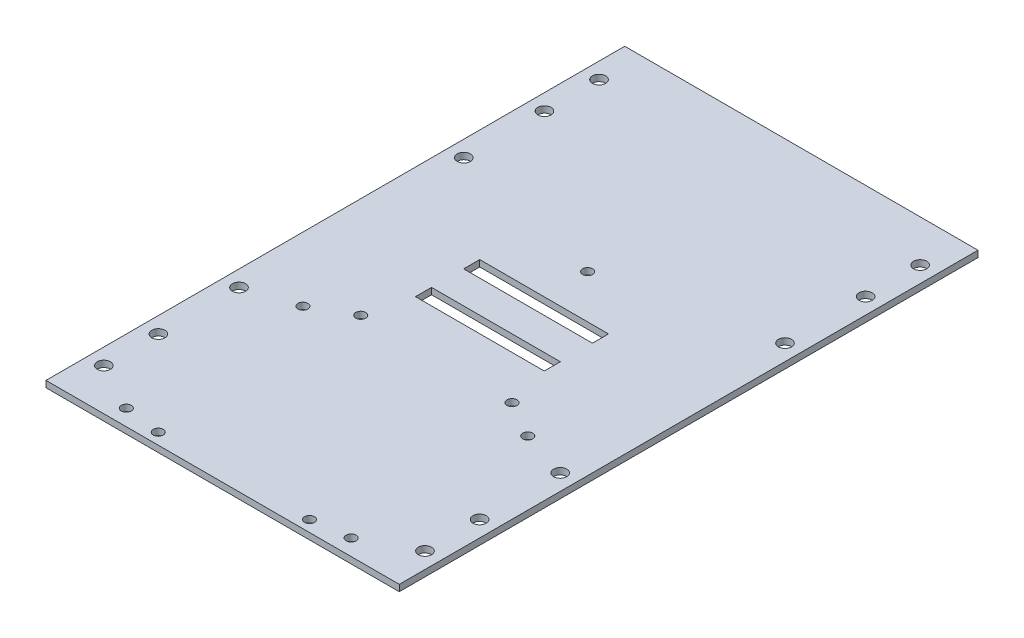
from build123d import *

# Parameters (mm, degrees)
SKETCH1_W           = 55
SKETCH1_H           = 90.1
SKETCH1_R           = 2.05
BOSS_EXTRUDE2_DEPTH = 2
MIRROR1_OUTLINE_W   = 55
MIRROR1_OUTLINE_H   = 90.1
MIRROR1_OUTLINE_R   = 2.05
MIRROR1_DEPTH       = 2
SKETCH2_W           = 40.1
SKETCH2_H           = 5
CUT_EXTRUDE1_DEPTH  = 10
SKETCH3_R           = 1.55
CUT_EXTRUDE2_DEPTH  = 10


# Read off the part's stored shape, not the designer's step: Mirror1
with BuildPart() as part:
    # Sketch1 → Boss-Extrude2 (new body)
    with BuildSketch(Plane(origin=(0, 0, 0), x_dir=(1, 0, 0), z_dir=(0, 1, 0))):
        with Locations((27.5, 45.05)):
            Rectangle(SKETCH1_W, SKETCH1_H)
        with Locations(Location((50, 77.1, 0), (0, 0, 270))):
            Circle(SKETCH1_R, mode=Mode.SUBTRACT)
        with Locations(Location((50, 60.1, 0), (0, 0, 270))):
            Circle(SKETCH1_R, mode=Mode.SUBTRACT)
        with Locations(Location((50, 35, 0), (0, 0, 270))):
            Circle(SKETCH1_R, mode=Mode.SUBTRACT)
    extrude(amount=BOSS_EXTRUDE2_DEPTH)

    # Mirror1 outline → Mirror1 (add)
    with BuildSketch(Plane(origin=(0, 0, 0), x_dir=(1, 0, 0), z_dir=(0, 1, 0))):
        with Locations((-27.5, 45.05)):
            Rectangle(MIRROR1_OUTLINE_W, MIRROR1_OUTLINE_H)
        with Locations((-50, 35)):
            Circle(MIRROR1_OUTLINE_R, mode=Mode.SUBTRACT)
        with Locations((-50, 60.1)):
            Circle(MIRROR1_OUTLINE_R, mode=Mode.SUBTRACT)
        with Locations((-50, 77.1)):
            Circle(MIRROR1_OUTLINE_R, mode=Mode.SUBTRACT)
    extrude(amount=MIRROR1_DEPTH)

    # Mirror2: part across plane


with BuildPart() as part_1:
    add(part.part)
    add(part.part.mirror(Plane(origin=(0, 2, 0), x_dir=(1, 0, 0), z_dir=(0, 0, -1))))

    # Sketch2 → Cut-Extrude1 (cut)
    with BuildSketch(Plane(origin=(0, 2, 0), x_dir=(1, 0, 0), z_dir=(0, 1, 0))):
        with Locations((0, 7.5)):
            Rectangle(SKETCH2_W, SKETCH2_H)
        with Locations((0, -7.5)):
            Rectangle(SKETCH2_W, SKETCH2_H)
    extrude(amount=-CUT_EXTRUDE1_DEPTH, mode=Mode.SUBTRACT)

    # Sketch3 → Cut-Extrude2 (cut)
    with BuildSketch(Plane(origin=(0, 2, 0), x_dir=(1, 0, 0), z_dir=(0, 1, 0))):
        with Locations(Location((-35, -30.1, 0), (0, 0, 270))):
            Circle(SKETCH3_R)
        with Locations(Location((-35, -85.1, 0), (0, 0, 270))):
            Circle(SKETCH3_R)
        with Locations(Location((35, -30.1, 0), (0, 0, 270))):
            Circle(SKETCH3_R)
        with Locations(Location((35, -85.1, 0), (0, 0, 270))):
            Circle(SKETCH3_R)
        with Locations(Location((0, 23.55, 0), (0, 0, 270))):
            Circle(SKETCH3_R)
        with Locations(Location((23.55, -23.55, 0), (0, 0, 270))):
            Circle(SKETCH3_R)
        with Locations(Location((-23.55, -86.6, 0), (0, 0, 270))):
            Circle(SKETCH3_R)
        with Locations(Location((23.55, -86.6, 0), (0, 0, 270))):
            Circle(SKETCH3_R)
        with Locations(Location((-23.55, -23.55, 0), (0, 0, 270))):
            Circle(SKETCH3_R)
    extrude(amount=-CUT_EXTRUDE2_DEPTH, mode=Mode.SUBTRACT)


solid = part_1.part
